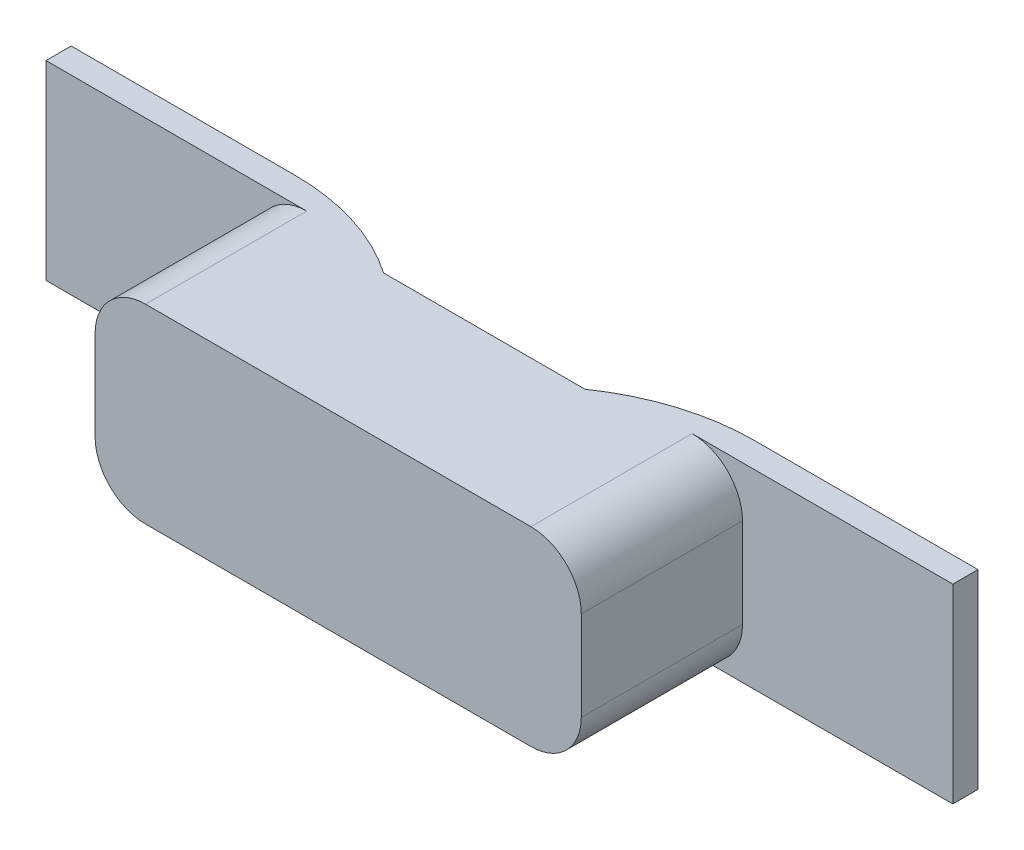
from build123d import *

# Parameters (mm, degrees)
SKETCH1_W           = 18
SKETCH1_H           = 3.78
BOSS_EXTRUDE1_DEPTH = 0.5
BOSS_EXTRUDE2_DEPTH = 3.2
SKETCH4_W           = 4
SKETCH4_H           = 3.78
CUT_EXTRUDE1_DEPTH  = 0.8
FILLET1_R           = 4.5


with BuildPart() as part:
    # Sketch1 → Boss-Extrude1 (new body)
    with BuildSketch(Plane.XY):
        Rectangle(SKETCH1_W, SKETCH1_H)
    extrude(amount=BOSS_EXTRUDE1_DEPTH)

    # Sketch3 → Boss-Extrude2 (add)
    with BuildSketch(Plane.XY.offset(0.5)):
        with BuildLine():
            Line((-3.825, -1.89), (3.825, -1.89))
            ThreePointArc((3.825, -1.89), (4.532106781, -1.597106781), (4.825, -0.89))
            Line((4.825, -0.89), (4.825, 0.89))
            ThreePointArc((4.825, 0.89), (4.532106781, 1.597106781), (3.825, 1.89))
            Line((3.825, 1.89), (-3.825, 1.89))
            ThreePointArc((-3.825, 1.89), (-4.532106781, 1.597106781), (-4.825, 0.89))
            Line((-4.825, 0.89), (-4.825, -0.89))
            ThreePointArc((-4.825, -0.89), (-4.532106781, -1.597106781), (-3.825, -1.89))
        make_face()
    extrude(amount=BOSS_EXTRUDE2_DEPTH)

    # Sketch4 → Cut-Extrude1 (cut)
    with BuildSketch(Plane(origin=(0, 0, 0), x_dir=(-1, 0, 0), z_dir=(0, 0, -1))):
        Rectangle(SKETCH4_W, SKETCH4_H)
    extrude(amount=-CUT_EXTRUDE1_DEPTH, mode=Mode.SUBTRACT)

    # Fillet1
    # the kernel refuses this fillet: 4.5 mm, written as the material it takes off along each edge
    with BuildSketch(Plane(origin=(-2, -8.293124237, 0), x_dir=(-1, 0, 0), z_dir=(0, 1, 0))) as fillet1_piece_1:
        with BuildLine():
            CenterArc((2.561249695, 4.5), FILLET1_R, 235.307869415, 34.692130585)
            Line((0, 0.8), (-0.051224994, 0.726))
            ThreePointArc((-0.051224994, 0.726), (-0.09, 0.4), (-0.09, 0))
            Line((-0.09, 0), (0, -0.09))
            Line((0, -0.09), (2.561249695, -0.09))
            Line((2.561249695, -0.09), (2.561249695, 0))
        make_face()
    extrude(amount=16.586248475, mode=Mode.SUBTRACT)
    with BuildSketch(Plane(origin=(2, 8.293124237, 0), x_dir=(1.0735856648108615e-12, 0, 1.0), z_dir=(0, -1, 0))) as fillet1_piece_2:
        with BuildLine():
            CenterArc((4.5, -2.561249695), FILLET1_R, 145.307869415, 34.692130585)
            Line((0, -2.561249695), (-0.09, -2.561249695))
            Line((-0.09, -2.561249695), (-0.09, 0))
            Line((-0.09, 0), (0, 0.09))
            ThreePointArc((0, 0.09), (0.4, 0.09), (0.726, 0.051224994))
            Line((0.726, 0.051224994), (0.8, 0))
        make_face()
    extrude(amount=16.586248475, mode=Mode.SUBTRACT)


solid = part.part
